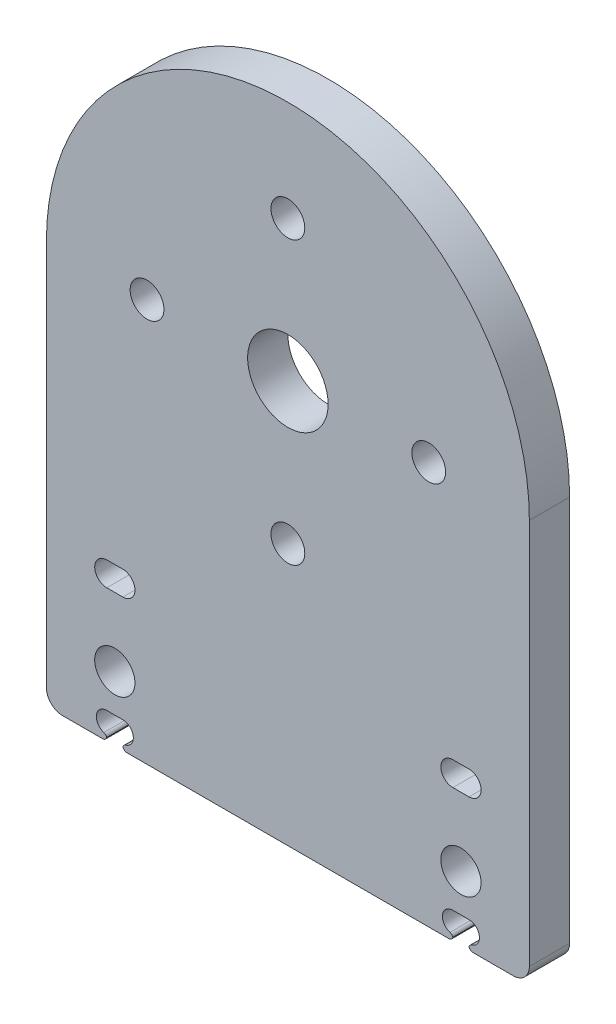
from build123d import *

# Parameters (mm, degrees)
SKETCH1_R           = 2.5
BOSS_EXTRUDE1_DEPTH = 2.5
SKETCH2_R           = 5
CUT_EXTRUDE1_DEPTH  = 5
FILLET1_R           = 0.5
FILLET2_R           = 2


with BuildPart() as part:
    # Sketch1 → Boss-Extrude1 (new, symmetric)
    # profile 1 of 2: a face of its own
    with BuildSketch(Plane.XY):
        with BuildLine():
            Line((-30, 25), (-30, -25))
            Line((-30, -25), (-22.5, -25))
            Line((-22.5, -25), (-22.5, -24.3))
            ThreePointArc((-22.5, -24.3), (-23.8, -23), (-22.5, -21.7))
            Line((-22.5, -21.7), (-20.5, -21.7))
            ThreePointArc((-20.5, -21.7), (-19.2, -23), (-20.5, -24.3))
            Line((-20.5, -24.3), (-20.5, -25))
            Line((-20.5, -25), (20.5, -25))
            Line((20.5, -25), (20.5, -24.3))
            ThreePointArc((20.5, -24.3), (19.2, -23), (20.5, -21.7))
            Line((20.5, -21.7), (22.5, -21.7))
            ThreePointArc((22.5, -21.7), (23.8, -23), (22.5, -24.3))
            Line((22.5, -24.3), (22.5, -25))
            Line((22.5, -25), (30, -25))
            Line((30, -25), (30, 25))
            Line((30, 25), (-30, 25))
        make_face()
        with Locations((-21.5, -17)):
            Circle(SKETCH1_R, mode=Mode.SUBTRACT)
        with BuildLine():
            Line((-22.5, -5.5), (-20.5, -5.5))
            ThreePointArc((-20.5, -5.5), (-19, -7), (-20.5, -8.5))
            Line((-20.5, -8.5), (-22.5, -8.5))
            ThreePointArc((-22.5, -8.5), (-24, -7), (-22.5, -5.5))
        make_face(mode=Mode.SUBTRACT)
        with Locations((21.5, -17)):
            Circle(SKETCH1_R, mode=Mode.SUBTRACT)
        with BuildLine():
            ThreePointArc((20.5, -8.5), (19, -7), (20.5, -5.5))
            Line((20.5, -5.5), (22.5, -5.5))
            ThreePointArc((22.5, -5.5), (24, -7), (22.5, -8.5))
            Line((22.5, -8.5), (20.5, -8.5))
        make_face(mode=Mode.SUBTRACT)
    # profile 2 of 2: a face of its own
    with BuildSketch(Plane.XY):
        with BuildLine():
            ThreePointArc((30, 25), (0, 55), (-30, 25))
            Line((-30, 25), (30, 25))
        make_face()
    extrude(amount=BOSS_EXTRUDE1_DEPTH, both=True)

    # Sketch2 → Cut-Extrude1 (cut)
    with BuildSketch(Plane.XY.offset(2.5)):
        with Locations((0, 25)):
            Circle(SKETCH2_R)
        with BuildLine():
            ThreePointArc((-17.5, 27.1), (-19.6, 25), (-17.5, 22.9))
            Line((-17.5, 22.9), (-17.5, 27.1))
        make_face()
        with BuildLine():
            Line((-17.5, 27.1), (-17.5, 22.9))
            ThreePointArc((-17.5, 22.9), (-16.01507576, 23.51507576), (-15.4, 25))
            ThreePointArc((-15.4, 25), (-16.01507576, 26.48492424), (-17.5, 27.1))
        make_face()
        with BuildLine():
            ThreePointArc((17.5, 27.1), (15.4, 25), (17.5, 22.9))
            Line((17.5, 22.9), (17.5, 27.1))
        make_face()
        with BuildLine():
            Line((17.5, 27.1), (17.5, 22.9))
            ThreePointArc((17.5, 22.9), (18.98492424, 23.51507576), (19.6, 25))
            ThreePointArc((19.6, 25), (18.98492424, 26.48492424), (17.5, 27.1))
        make_face()
        with BuildLine():
            ThreePointArc((-2.1, 42.5), (0, 40.4), (2.1, 42.5))
            Line((2.1, 42.5), (-2.1, 42.5))
        make_face()
        with BuildLine():
            Line((-2.1, 42.5), (2.1, 42.5))
            ThreePointArc((2.1, 42.5), (0, 44.6), (-2.1, 42.5))
        make_face()
        with BuildLine():
            ThreePointArc((-2.1, 7.5), (0, 5.4), (2.1, 7.5))
            Line((2.1, 7.5), (-2.1, 7.5))
        make_face()
        with BuildLine():
            Line((-2.1, 7.5), (2.1, 7.5))
            ThreePointArc((2.1, 7.5), (0, 9.6), (-2.1, 7.5))
        make_face()
    extrude(amount=-CUT_EXTRUDE1_DEPTH, mode=Mode.SUBTRACT)

    # Fillet1
    # the kernel refuses this fillet: 0.5 mm, written as the material it takes off along each edge
    with BuildSketch(Plane(origin=(22.5, -25, -3.75), x_dir=(1, 0, 0), z_dir=(0, 0, 1))) as fillet1_piece_1:
        with BuildLine():
            CenterArc((FILLET1_R, FILLET1_R), FILLET1_R, 180, 90)
            Line((0, FILLET1_R), (0, 0))
            Line((0, 0), (FILLET1_R, 0))
        make_face()
    extrude(amount=7.5, mode=Mode.SUBTRACT)
    with BuildSketch(Plane(origin=(20.5, -25, -3.75), x_dir=(-1, 0, 0), z_dir=(0, 0, 1)), Plane(origin=(-20.5, -25, -3.75), x_dir=(0, 1, 0), z_dir=(0, 0, 1)), Plane(origin=(-22.5, -25, -3.75), x_dir=(-1, 0, 0), z_dir=(0, 0, 1))) as fillet1_piece_2:
        with BuildLine():
            CenterArc((FILLET1_R, -FILLET1_R), FILLET1_R, 90, 90)
            Line((0, -FILLET1_R), (0, 0))
            Line((0, 0), (FILLET1_R, 0))
        make_face()
    extrude(amount=7.5, mode=Mode.SUBTRACT)
    with BuildSketch(Plane(origin=(22.5, -24.3, -3.572904116), x_dir=(0, -1, 0), z_dir=(0, 0, 1))) as fillet1_piece_3:
        with BuildLine():
            CenterArc((0.429161647, 0.5), FILLET1_R, 196.127620213, 73.872379787)
            ThreePointArc((-0.051161033, 0.361111111), (-0.012853805, 0.182358634), (0, 0))
            Line((0, 0), (0.429161647, 0))
        make_face()
    extrude(amount=7.145808233, mode=Mode.SUBTRACT)
    with BuildSketch(Plane(origin=(20.5, -24.3, -3.572904116), x_dir=(-0.9901124580598394, 0.1402758724610287, 0), z_dir=(0, 0, 1))) as fillet1_piece_4:
        with BuildLine():
            CenterArc((0.434855205, 0.495056229), FILLET1_R, 188.063810107, 73.872379787)
            Line((-0.060201024, 0.424918293), (0, 0))
            ThreePointArc((0, 0), (0.182358634, 0.012853805), (0.364717268, 0))
        make_face()
    extrude(amount=7.145808233, mode=Mode.SUBTRACT)
    with BuildSketch(Plane(origin=(-20.5, -24.3, -3.572904116), x_dir=(0.9901124580598384, 0.14027587246103554, 0), z_dir=(0, 0, 1))) as fillet1_piece_5:
        with BuildLine():
            CenterArc((0.434855205, -0.495056229), FILLET1_R, 98.063810107, 73.872379787)
            Line((-0.060201024, -0.424918293), (0, 0))
            ThreePointArc((0, 0), (0.182358634, -0.012853805), (0.364717268, 0))
        make_face()
    extrude(amount=7.145808233, mode=Mode.SUBTRACT)
    with BuildSketch(Plane(origin=(-22.5, -24.3, -3.572904116), x_dir=(0, -1, 0), z_dir=(0, 0, 1))) as fillet1_piece_6:
        with BuildLine():
            CenterArc((0.429161647, -0.5), FILLET1_R, 90, 73.872379787)
            ThreePointArc((-0.051161033, -0.361111111), (-0.012853805, -0.182358634), (0, 0))
            Line((0, 0), (0.429161647, 0))
        make_face()
    extrude(amount=7.145808233, mode=Mode.SUBTRACT)

    # Fillet2
    fillet2_edges = [part.edges().sort_by_distance(p)[0] for p in [
        (-30, -25, 0),
        (30, -25, 0),
    ]]
    fillet(fillet2_edges, radius=FILLET2_R)


solid = part.part
